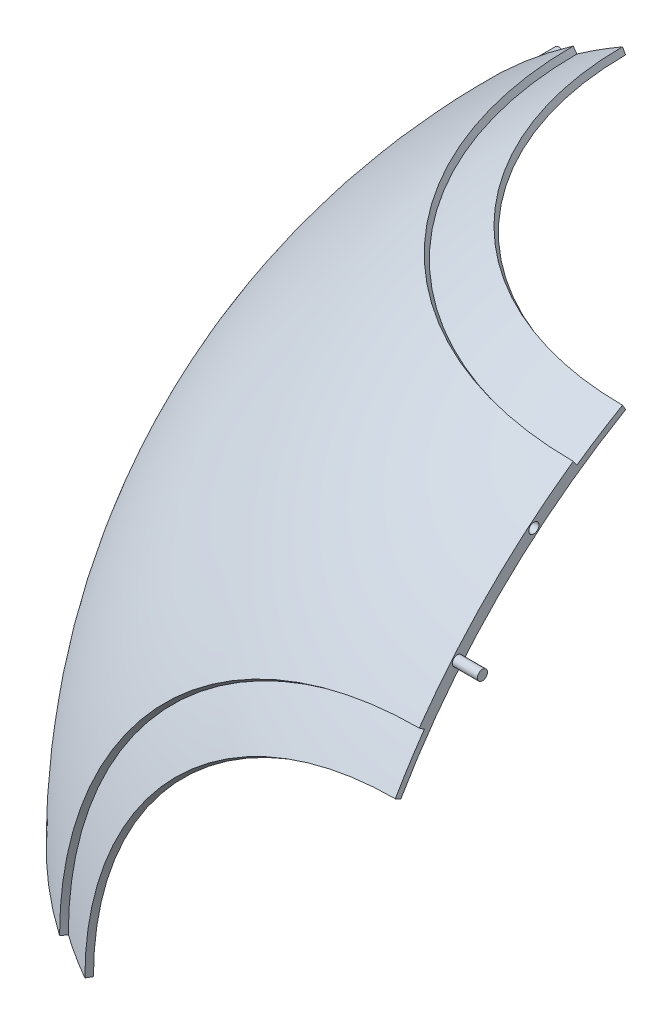
from build123d import *

# Parameters (mm, degrees)
REVOLVE1_ANGLE      = 90
SKETCH4_R           = 2
BOSS_EXTRUDE1_DEPTH = 10
SKETCH4_4_R         = 2.025
CUT_EXTRUDE2_DEPTH  = 10
SKETCH5_R           = 2
BOSS_EXTRUDE2_DEPTH = 10
SKETCH5_3_R         = 2.025
CUT_EXTRUDE3_DEPTH  = 10
SKETCH6_R           = 2
BOSS_EXTRUDE3_DEPTH = 10
SKETCH6_3_R         = 2.025
CUT_EXTRUDE4_DEPTH  = 10


with BuildPart() as part:
    # Sketch1 → Revolve1 (revolve)
    with BuildSketch(Plane.XY):
        with BuildLine():
            ThreePointArc((-245, 0), (-212.176223927, 122.5), (-122.5, 212.176223927))
            Line((-122.5, 212.176223927), (-123.75, 214.341287437))
            ThreePointArc((-123.75, 214.341287437), (-132.981653066, 208.739382839), (-141.960167997, 202.740130962))
            Line((-141.960167997, 202.740130962), (-143.394109088, 204.788011072))
            ThreePointArc((-143.394109088, 204.788011072), (-221.752708295, 115.437153309), (-250, 0))
            Line((-250, 0), (-245, 0))
        make_face()
    revolve(axis=Axis((0, 0, 0), (0, 1, 0)), revolution_arc=REVOLVE1_ANGLE)

    # Sketch2 → Cut-Revolve2 (revolve, cut)
    with BuildSketch(Plane(origin=(0, 0, 0), x_dir=(0, 0, -1), z_dir=(1, 0, 0))):
        with BuildLine():
            Line((-250, 0), (-245, 0))
            ThreePointArc((-245, 0), (-236.651827441, 63.41066605), (-212.176223927, 122.5))
            Line((-212.176223927, 122.5), (-214.341287437, 123.75))
            ThreePointArc((-214.341287437, 123.75), (-208.739382839, 132.981653066), (-202.740130962, 141.960167997))
            Line((-202.740130962, 141.960167997), (-204.788011072, 143.394109088))
            ThreePointArc((-204.788011072, 143.394109088), (-238.429237687, 75.176449876), (-250, 0))
        make_face()
    revolve(axis=Axis((0, 0, 0), (0, 0, 1)), mode=Mode.SUBTRACT)

    # Sketch3 → Cut-Revolve3 (revolve, cut)
    with BuildSketch(Plane(origin=(0, 0, 0), x_dir=(-1, 0, 0), z_dir=(0, 0, -1))):
        with BuildLine():
            ThreePointArc((212.176223927, 122.5), (236.651827441, 63.41066605), (245, 0))
            Line((245, 0), (250, 0))
            ThreePointArc((250, 0), (238.429237687, 75.176449876), (204.788011072, 143.394109088))
            Line((204.788011072, 143.394109088), (202.740130962, 141.960167997))
            ThreePointArc((202.740130962, 141.960167997), (208.739382839, 132.981653066), (214.341287437, 123.75))
            Line((214.341287437, 123.75), (212.176223927, 122.5))
        make_face()
    revolve(axis=Axis((0, 0, 0), (-1, 0, 0)), mode=Mode.SUBTRACT)

    # Sketch4 → Boss-Extrude1 (add)
    with BuildSketch(Plane(origin=(0, 0, 0), x_dir=(-1, 0, 0), z_dir=(0, 0, -1))):
        with Locations((159.089933397, 189.595999672)):
            Circle(SKETCH4_R)
    extrude(amount=BOSS_EXTRUDE1_DEPTH)

    # Sketch4<4> → Cut-Extrude2 (cut)
    with BuildSketch(Plane(origin=(0, 0, 0), x_dir=(-1, 0, 0), z_dir=(0, 0, -1))):
        with Locations((189.595999672, 159.089933397)):
            Circle(SKETCH4_4_R)
    extrude(amount=-CUT_EXTRUDE2_DEPTH, mode=Mode.SUBTRACT)

    # Sketch5 → Boss-Extrude2 (add)
    with BuildSketch(Plane(origin=(0, 0, 0), x_dir=(0, 0, -1), z_dir=(1, 0, 0))):
        with Locations((-189.595999672, 159.089933397)):
            Circle(SKETCH5_R)
    extrude(amount=BOSS_EXTRUDE2_DEPTH)

    # Sketch5<3> → Cut-Extrude3 (cut)
    with BuildSketch(Plane(origin=(0, 0, 0), x_dir=(0, 0, -1), z_dir=(1, 0, 0))):
        with Locations((-159.089933397, 189.595999672)):
            Circle(SKETCH5_3_R)
    extrude(amount=-CUT_EXTRUDE3_DEPTH, mode=Mode.SUBTRACT)

    # Sketch6 → Boss-Extrude3 (add)
    with BuildSketch(Plane.XZ):
        with Locations((-189.595999672, 159.089933397)):
            Circle(SKETCH6_R)
    extrude(amount=BOSS_EXTRUDE3_DEPTH)

    # Sketch6<3> → Cut-Extrude4 (cut)
    with BuildSketch(Plane.XZ):
        with Locations((-159.089933397, 189.595999672)):
            Circle(SKETCH6_3_R)
    extrude(amount=-CUT_EXTRUDE4_DEPTH, mode=Mode.SUBTRACT)


solid = part.part
